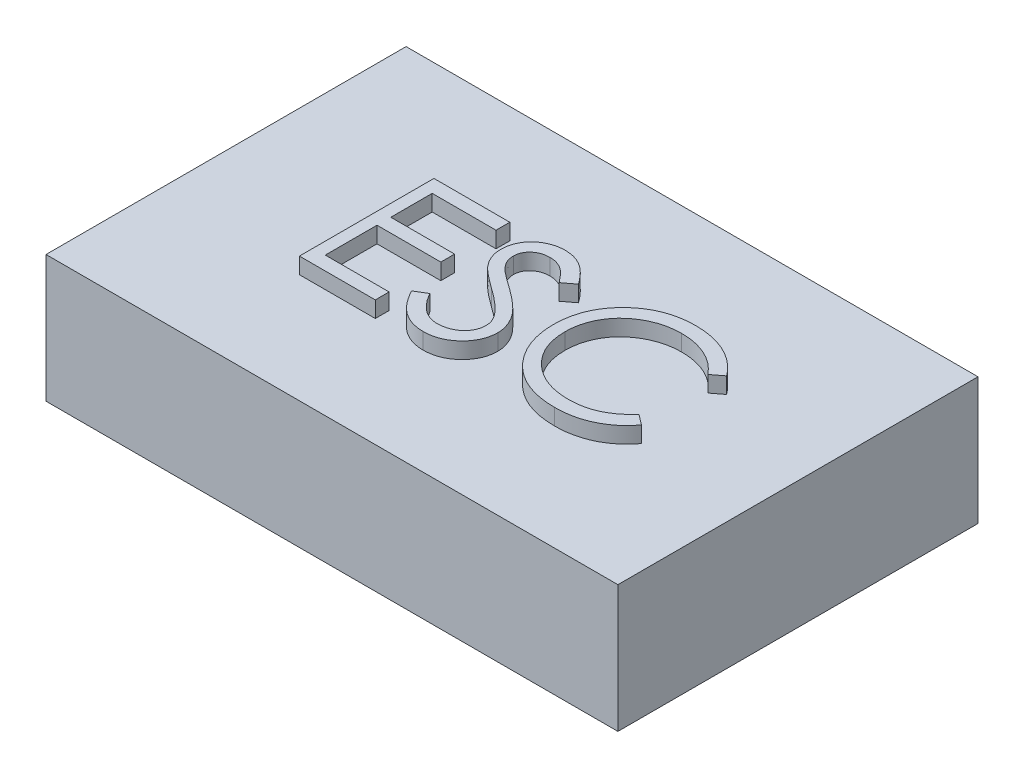
from build123d import *

# Parameters (mm, degrees)
SKETCH1_W           = 27
SKETCH1_H           = 17
BOSS_EXTRUDE1_DEPTH = 6
WRAP1_DEPTH         = 0.762


# Read off the part's stored shape, not the designer's step: Wrap1
with BuildPart() as part:
    # Sketch1 → Boss-Extrude1 (new body)
    with BuildSketch(Plane(origin=(0, 0, 0), x_dir=(1, 0, 0), z_dir=(0, 1, 0))):
        Rectangle(SKETCH1_W, SKETCH1_H)
    extrude(amount=BOSS_EXTRUDE1_DEPTH)

    # Wrap1 outline → Wrap1 (add)
    with BuildSketch(Plane(origin=(0, 6, 0), x_dir=(1, 0, 0), z_dir=(0, 1, 0))):
        with BuildLine():
            add(Edge.make_bspline(
                [(-2.083282599, -1.798468274), (-2.033356654, -1.88204223), (-1.937700471, -2.042166703), (-1.778131576, -2.258534862), (-1.612790437, -2.442434775), (-1.440452647, -2.59279662), (-1.262170141, -2.711176743), (-1.076779072, -2.795000792), (-0.884904187, -2.847281205), (-0.75432311, -2.853631362), (-0.689131958, -2.856801607)],
                knots=[0, 0, 0, 0, 0.159004299, 0.3046461, 0.438546905, 0.562322299, 0.677432543, 0.786897393, 0.893610889, 1, 1, 1, 1], degree=3))
            Line((-2.083282599, -1.798468274), (-2.620081477, -2.120293194))
            add(Edge.make_bspline(
                [(-0.689131958, -3.508083659), (-0.737093223, -3.507156229), (-0.83241173, -3.50531305), (-0.973398933, -3.489018441), (-1.111537902, -3.465964125), (-1.245095243, -3.429362598), (-1.375791689, -3.384954368), (-1.503058815, -3.330274822), (-1.626958298, -3.264747899), (-1.748184484, -3.189826926), (-1.866429058, -3.102636447), (-1.98058295, -3.001084532), (-2.094391615, -2.887971973), (-2.204495891, -2.760227093), (-2.313122882, -2.619913714), (-2.418130853, -2.465719053), (-2.521693398, -2.298482997), (-2.58667289, -2.180799199), (-2.620081477, -2.120293194)],
                knots=[0, 0, 0, 0, 0.057208269, 0.11369606, 0.169177916, 0.224159217, 0.278719878, 0.333794217, 0.389241459, 0.445822073, 0.503704281, 0.564293892, 0.627975416, 0.69503826, 0.765372726, 0.839611443, 0.91753775, 1, 1, 1, 1], degree=3))
            add(Edge.make_bspline(
                [(1.124790318, -1.789564027), (1.123598082, -1.846493347), (1.121236761, -1.959246457), (1.094093389, -2.124809239), (1.054324854, -2.28561096), (0.994385872, -2.439663978), (0.921228142, -2.589786619), (0.82839795, -2.732040953), (0.720796865, -2.869575419), (0.597364177, -2.99872261), (0.46229804, -3.11727928), (0.319543337, -3.222742006), (0.168866413, -3.310677393), (0.011084667, -3.38243392), (-0.153838144, -3.438556159), (-0.325846552, -3.479219507), (-0.505224094, -3.504176297), (-0.627144967, -3.506766665), (-0.689131958, -3.508083659)],
                knots=[0, 0, 0, 0, 0.061484255, 0.121774528, 0.18091956, 0.240256115, 0.300114444, 0.361145948, 0.423500582, 0.488669361, 0.553954105, 0.617581261, 0.680238427, 0.742187389, 0.804663212, 0.868258989, 0.933020257, 1, 1, 1, 1], degree=3))
            add(Edge.make_bspline(
                [(-0.371123144, 0.259684771), (-0.302205844, 0.209535447), (-0.168757044, 0.112428232), (0.021121708, -0.033468787), (0.193286188, -0.17615831), (0.348340857, -0.314729112), (0.487817534, -0.44813008), (0.610168827, -0.577966136), (0.716641419, -0.703307104), (0.831266572, -0.864003062), (0.948392902, -1.06136303), (1.048979637, -1.303167834), (1.112404067, -1.545912587), (1.120698103, -1.709065562), (1.124790318, -1.789564027)],
                knots=[0, 0, 0, 0, 0.09697231, 0.187773439, 0.272396139, 0.351320997, 0.424334774, 0.491908784, 0.55423322, 0.611267658, 0.716347845, 0.814540086, 0.908495456, 1, 1, 1, 1], degree=3))
            add(Edge.make_bspline(
                [(-1.224658801, 0.891886293), (-1.210758882, 0.879481975), (-1.177735858, 0.850012154), (-1.117363821, 0.801766159), (-1.03763903, 0.742252558), (-0.940643322, 0.66861557), (-0.824588251, 0.583196346), (-0.689461057, 0.487087078), (-0.53676799, 0.377167745), (-0.428415371, 0.300319064), (-0.371123144, 0.259684771)],
                knots=[0, 0, 0, 0, 0.052594282, 0.124951974, 0.218093899, 0.333502411, 0.468789179, 0.624937586, 0.801683048, 1, 1, 1, 1], degree=3))
            add(Edge.make_bspline(
                [(-1.6431584, 1.712349034), (-1.642445156, 1.678328494), (-1.641017502, 1.610231785), (-1.621106083, 1.509627062), (-1.595525872, 1.409276489), (-1.554989954, 1.309631231), (-1.499027761, 1.208948609), (-1.425539799, 1.105494885), (-1.332987075, 0.998358213), (-1.26209021, 0.928676264), (-1.224658801, 0.891886293)],
                knots=[0, 0, 0, 0, 0.107285214, 0.214745861, 0.32293856, 0.434116163, 0.553412311, 0.686072985, 0.834255992, 1, 1, 1, 1], degree=3))
            add(Edge.make_bspline(
                [(-0.712028592, 2.516275316), (-0.777626855, 2.514076946), (-0.904126923, 2.509837597), (-1.083723495, 2.463537052), (-1.24536533, 2.390635677), (-1.384253555, 2.288464216), (-1.499890642, 2.167413273), (-1.583539117, 2.028114493), (-1.633885844, 1.874294991), (-1.640029523, 1.766995129), (-1.6431584, 1.712349034)],
                knots=[0, 0, 0, 0, 0.143073084, 0.275902964, 0.402370856, 0.528413645, 0.650356379, 0.765895086, 0.880774131, 1, 1, 1, 1], degree=3))
            add(Edge.make_bspline(
                [(0.528205783, 1.702172752), (0.497098162, 1.742247947), (0.437192159, 1.819423404), (0.346242947, 1.927502791), (0.2605204, 2.026229832), (0.176064675, 2.111982279), (0.097336229, 2.189456149), (0.020923881, 2.255785994), (-0.052072728, 2.311621717), (-0.144087694, 2.371209318), (-0.25968984, 2.430276118), (-0.404804642, 2.480258016), (-0.556454027, 2.510293629), (-0.659740644, 2.514264896), (-0.712028592, 2.516275316)],
                knots=[0, 0, 0, 0, 0.098469431, 0.189629101, 0.274184089, 0.352183161, 0.423198873, 0.488550946, 0.548473346, 0.601440164, 0.701198082, 0.799591802, 0.898545098, 1, 1, 1, 1], degree=3))
            Line((0.528205783, 1.702172752), (1.043380061, 2.092687575))
            add(Edge.make_bspline(
                [(-0.64842683, 3.167557367), (-0.573598248, 3.164976452), (-0.424788081, 3.159843836), (-0.205895933, 3.115216886), (0.004852796, 3.041374239), (0.174385576, 2.957574816), (0.307069301, 2.873879248), (0.408256973, 2.797643281), (0.510795776, 2.709877012), (0.615512819, 2.610346666), (0.720633729, 2.498138989), (0.827719135, 2.374022453), (0.937019452, 2.238755559), (1.007333655, 2.142191108), (1.043380061, 2.092687575)],
                knots=[0, 0, 0, 0, 0.107232799, 0.213251813, 0.318830447, 0.426793531, 0.483645951, 0.543603822, 0.60830765, 0.67712676, 0.750685636, 0.828713418, 0.912190348, 1, 1, 1, 1], degree=3))
            add(Edge.make_bspline(
                [(-2.213030195, 1.685636293), (-2.210662173, 1.752818884), (-2.205976744, 1.885748086), (-2.166351805, 2.079932592), (-2.103808127, 2.265327949), (-2.016187402, 2.440098698), (-1.903234776, 2.59969412), (-1.772522794, 2.745950018), (-1.61683624, 2.868901588), (-1.446016481, 2.97632918), (-1.259042777, 3.06041393), (-1.063116424, 3.123843137), (-0.857926022, 3.15978279), (-0.718946049, 3.164940378), (-0.64842683, 3.167557367)],
                knots=[0, 0, 0, 0, 0.083785371, 0.165779888, 0.246280008, 0.327460928, 0.408796954, 0.489715241, 0.571376032, 0.655523321, 0.741019483, 0.826546761, 0.911988852, 1, 1, 1, 1], degree=3))
            add(Edge.make_bspline(
                [(-1.858132358, 0.718889498), (-1.886203976, 0.756265665), (-1.94141058, 0.829770914), (-2.01428319, 0.944660298), (-2.076221385, 1.062268223), (-2.124775902, 1.18291072), (-2.165663042, 1.304894091), (-2.193163859, 1.429809922), (-2.210383965, 1.557097702), (-2.212147426, 1.642756481), (-2.213030195, 1.685636293)],
                knots=[0, 0, 0, 0, 0.133506769, 0.262558979, 0.388264447, 0.512667355, 0.63372227, 0.75539386, 0.877552945, 1, 1, 1, 1], degree=3))
            add(Edge.make_bspline(
                [(-0.817607519, -0.144822441), (-0.884416769, -0.097236289), (-1.012150968, -0.00625519), (-1.190782967, 0.128771725), (-1.350520779, 0.252222746), (-1.490654423, 0.365260025), (-1.611122263, 0.467898893), (-1.712873594, 0.559153726), (-1.793316405, 0.641492472), (-1.838048673, 0.694907478), (-1.858132358, 0.718889498)],
                knots=[0, 0, 0, 0, 0.181535301, 0.347081672, 0.495567816, 0.628357302, 0.74551967, 0.845830751, 0.930781807, 1, 1, 1, 1], degree=3))
            add(Edge.make_bspline(
                [(0.327224212, -1.157362505), (0.298793241, -1.120991839), (0.239105972, -1.044636176), (0.136494485, -0.93097982), (0.016087392, -0.813743546), (-0.117994772, -0.688450685), (-0.270636233, -0.56092854), (-0.437056152, -0.425096093), (-0.621503439, -0.286118946), (-0.750861097, -0.192914434), (-0.817607519, -0.144822441)],
                knots=[0, 0, 0, 0, 0.090279215, 0.189529918, 0.299197872, 0.418925887, 0.548376285, 0.68813637, 0.839083502, 1, 1, 1, 1], degree=3))
            add(Edge.make_bspline(
                [(0.554918523, -1.78065978), (0.552243702, -1.727789953), (0.546806182, -1.62031332), (0.50084764, -1.461745378), (0.428549721, -1.304823144), (0.361851781, -1.207756562), (0.327224212, -1.157362505)],
                knots=[0, 0, 0, 0, 0.234723374, 0.477158319, 0.728556284, 1, 1, 1, 1], degree=3))
            add(Edge.make_bspline(
                [(-0.689131958, -2.856801607), (-0.633457225, -2.855250987), (-0.523081937, -2.852176879), (-0.360590439, -2.822638853), (-0.202780598, -2.777259704), (-0.052904926, -2.7122703), (0.086968546, -2.633641905), (0.209626407, -2.538670983), (0.315664355, -2.432342581), (0.402403749, -2.313719764), (0.468951813, -2.186144366), (0.52010028, -2.055196569), (0.548484914, -1.918819309), (0.552760738, -1.826997469), (0.554918523, -1.78065978)],
                knots=[0, 0, 0, 0, 0.091263605, 0.180930311, 0.27008822, 0.360156133, 0.448342532, 0.532665842, 0.613833704, 0.693981527, 0.772715977, 0.849335172, 0.923967327, 1, 1, 1, 1], degree=3))
        make_face()
        with BuildLine():
            add(Edge.make_bspline(
                [(7.790255061, 1.457941982), (7.754684378, 1.500334528), (7.684022582, 1.584548075), (7.570340886, 1.702802391), (7.451865048, 1.813592223), (7.328640357, 1.917445347), (7.198448811, 2.010730051), (7.064444219, 2.098307623), (6.924384909, 2.176807662), (6.730706762, 2.271990508), (6.477345666, 2.371315675), (6.1584036, 2.454597252), (5.825462036, 2.507612814), (5.59831782, 2.51335474), (5.482783106, 2.516275316)],
                knots=[0, 0, 0, 0, 0.063163259, 0.125474941, 0.18712122, 0.248294346, 0.309294856, 0.369850066, 0.430973376, 0.49245599, 0.616147966, 0.740843698, 0.868182649, 1, 1, 1, 1], degree=3))
            Line((7.790255061, 1.457941982), (8.288892882, 1.839552559))
            add(Edge.make_bspline(
                [(5.518400093, 3.167557367), (5.591360635, 3.166682631), (5.735778681, 3.164951178), (5.949415636, 3.148067177), (6.157409572, 3.119921063), (6.359903782, 3.081610479), (6.557883386, 3.03406291), (6.749835251, 2.972122655), (6.936885726, 2.901299234), (7.117855116, 2.819731731), (7.291875143, 2.728170643), (7.458891607, 2.627630869), (7.61757785, 2.518237051), (7.769050475, 2.400919575), (7.910775601, 2.273196475), (8.046777141, 2.138580836), (8.172436526, 1.993195184), (8.250003036, 1.890860518), (8.288892882, 1.839552559)],
                knots=[0, 0, 0, 0, 0.068547537, 0.135682946, 0.20121499, 0.265682235, 0.329266835, 0.392395428, 0.455069762, 0.51712685, 0.578790035, 0.639739863, 0.700191504, 0.759806243, 0.819628319, 0.879354791, 0.939511608, 1, 1, 1, 1], degree=3))
            add(Edge.make_bspline(
                [(2.101713395, -0.133374123), (2.10453496, -0.019154943), (2.110086214, 0.205564163), (2.157250014, 0.535354049), (2.233121259, 0.851314444), (2.340884185, 1.152855524), (2.477509608, 1.441563318), (2.646286465, 1.715232361), (2.845253994, 1.97561284), (3.072851724, 2.218753889), (3.322438176, 2.441075286), (3.589716595, 2.636666541), (3.874163842, 2.799439749), (4.17264623, 2.935504215), (4.487398823, 3.040087741), (4.817750079, 3.113299951), (5.163079253, 3.158869577), (5.398686797, 3.164630311), (5.518400093, 3.167557367)],
                knots=[0, 0, 0, 0, 0.064557846, 0.127013532, 0.18795481, 0.248013913, 0.307747682, 0.368234515, 0.429469844, 0.492743437, 0.556257769, 0.618216786, 0.679655476, 0.741245546, 0.803415265, 0.866815462, 0.932328312, 1, 1, 1, 1], degree=3))
            add(Edge.make_bspline(
                [(2.906911712, -2.39759688), (2.84262133, -2.318600723), (2.714816737, -2.16156212), (2.551302996, -1.907043268), (2.411335289, -1.641308089), (2.298167547, -1.362960504), (2.209698017, -1.072625101), (2.148409277, -0.770155525), (2.108582795, -0.455834259), (2.104028414, -0.242044656), (2.101713395, -0.133374123)],
                knots=[0, 0, 0, 0, 0.12432851, 0.247156016, 0.368779749, 0.490733862, 0.613613772, 0.738957576, 0.867310575, 1, 1, 1, 1], degree=3))
            add(Edge.make_bspline(
                [(5.526032305, -3.508083659), (5.457735938, -3.507608329), (5.322688328, -3.506668424), (5.123300593, -3.491442635), (4.929190925, -3.470669541), (4.740914104, -3.439391017), (4.557442692, -3.402480572), (4.380439918, -3.35300272), (4.208164036, -3.297577804), (4.041307189, -3.232435899), (3.879727448, -3.158927968), (3.723945962, -3.075848997), (3.574034377, -2.983897614), (3.428518828, -2.885100667), (3.289548926, -2.776284705), (3.155920387, -2.658960953), (3.026883895, -2.533524848), (2.947050452, -2.4430739), (2.906911712, -2.39759688)],
                knots=[0, 0, 0, 0, 0.069662801, 0.137749562, 0.203916744, 0.268779862, 0.332413706, 0.39475354, 0.456180032, 0.516995649, 0.577395938, 0.637198344, 0.696999184, 0.756756194, 0.816553905, 0.876947997, 0.938131788, 1, 1, 1, 1], degree=3))
            add(Edge.make_bspline(
                [(8.288892882, -2.176262745), (8.248764311, -2.228039651), (8.168699383, -2.331345454), (8.039054124, -2.47698127), (7.902479598, -2.613967163), (7.757961382, -2.741198704), (7.60716196, -2.861221806), (7.447373622, -2.970626557), (7.280696949, -3.070940019), (7.10769668, -3.162791724), (6.928556625, -3.244284444), (6.743491436, -3.314050566), (6.55329882, -3.374148579), (6.357970084, -3.423591379), (6.157100068, -3.462183203), (5.951413636, -3.487981755), (5.740466863, -3.505656372), (5.598151713, -3.507267305), (5.526032305, -3.508083659)],
                knots=[0, 0, 0, 0, 0.061674239, 0.123053062, 0.183475001, 0.243726501, 0.304278917, 0.364862921, 0.425946204, 0.48739123, 0.549220384, 0.611143589, 0.67352853, 0.736961457, 0.800785283, 0.866012596, 0.932100748, 1, 1, 1, 1], degree=3))
            Line((8.288892882, -2.176262745), (7.790255061, -1.798468274))
            add(Edge.make_bspline(
                [(5.522216199, -2.856801607), (5.633073935, -2.853737678), (5.851268478, -2.847707133), (6.171250469, -2.79661821), (6.477566787, -2.713781702), (6.770233908, -2.597852614), (7.048426766, -2.447148449), (7.312580707, -2.264453728), (7.562918699, -2.04803061), (7.713452311, -1.882779792), (7.790255061, -1.798468274)],
                knots=[0, 0, 0, 0, 0.12851519, 0.252948636, 0.374754734, 0.495939754, 0.617180641, 0.740909469, 0.867811148, 1, 1, 1, 1], degree=3))
            add(Edge.make_bspline(
                [(2.67158519, -0.176623322), (2.67387449, -0.270478717), (2.678369227, -0.454751335), (2.718371205, -0.724663728), (2.779159013, -0.983236951), (2.870264417, -1.228854665), (2.982603266, -1.464545543), (3.12455409, -1.686321748), (3.288958379, -1.897534658), (3.478141969, -2.093192578), (3.685706806, -2.271924622), (3.908406589, -2.429314963), (4.145686654, -2.560514821), (4.394927111, -2.669691181), (4.658045918, -2.753614101), (4.934569916, -2.812694726), (5.223897679, -2.85123411), (5.421599305, -2.854923801), (5.522216199, -2.856801607)],
                knots=[0, 0, 0, 0, 0.064323217, 0.126290104, 0.186726469, 0.246146432, 0.305575643, 0.365429386, 0.426326309, 0.488839906, 0.551724972, 0.613918596, 0.675483766, 0.737333897, 0.800229044, 0.864502298, 0.931040739, 1, 1, 1, 1], degree=3))
            add(Edge.make_bspline(
                [(5.482783106, 2.516275316), (5.419131977, 2.515542412), (5.292420462, 2.514083408), (5.104372518, 2.494835423), (4.919835982, 2.467782228), (4.738930893, 2.42764057), (4.561887526, 2.376890247), (4.387548453, 2.316246996), (4.218437794, 2.241217501), (4.052216133, 2.158289658), (3.892959564, 2.064622722), (3.742273978, 1.962454212), (3.60070895, 1.852927423), (3.468152497, 1.735631844), (3.344469105, 1.611095716), (3.230554984, 1.477991839), (3.126804311, 1.336745753), (3.031160565, 1.189219999), (2.945503178, 1.035844292), (2.873784682, 0.876050949), (2.810275389, 0.712576363), (2.760021049, 0.543573542), (2.720243711, 0.370231667), (2.692797808, 0.192085523), (2.673768724, 0.009507276), (2.672316975, -0.114243906), (2.67158519, -0.176623322)],
                knots=[0, 0, 0, 0, 0.043954909, 0.087501875, 0.130462627, 0.172752021, 0.215403067, 0.25764983, 0.300152749, 0.34312149, 0.385925163, 0.427685727, 0.46881795, 0.5094918, 0.549883031, 0.589980023, 0.63040523, 0.670868626, 0.711383944, 0.751627258, 0.791775577, 0.832458919, 0.873319045, 0.914542956, 0.956923558, 1, 1, 1, 1], degree=3))
        make_face()
        Polygon((-3.108543016, 2.353454803), (-3.108543016, 3.004736854), (-6.690594298, 3.004736854), (-6.690594298, -3.345263146), (-3.108543016, -3.345263146), (-3.108543016, -2.693981095), (-6.120722503, -2.693981095), (-6.120722503, -0.251673402), (-3.108543016, -0.251673402), (-3.108543016, 0.399608649), (-6.120722503, 0.399608649), (-6.120722503, 2.353454803), align=None)
    extrude(amount=WRAP1_DEPTH)


solid = part.part
